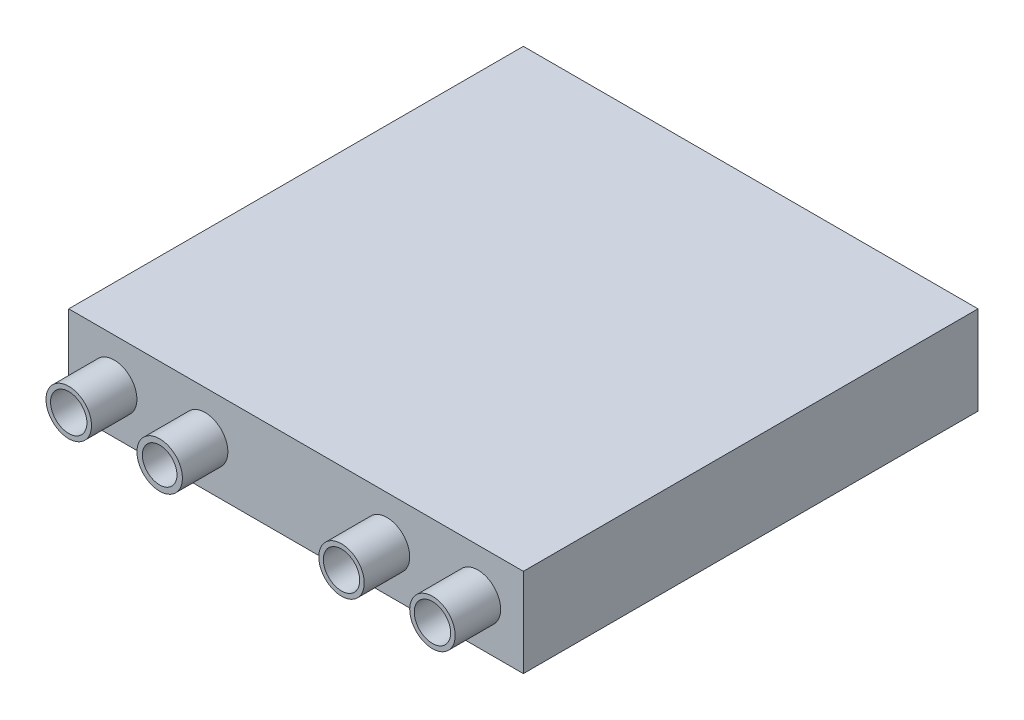
from build123d import *

# Parameters (mm, degrees)
SKETCH1_W           = 1000
SKETCH1_H           = 195
BOSS_EXTRUDE1_DEPTH = 1000
SKETCH2_R           = 50
SKETCH2_R_2         = 40
SKETCH2_R_3         = 38.049771674
BOSS_EXTRUDE2_DEPTH = 100
CUT_EXTRUDE1_START  = -964
SKETCH5_R           = 40
SKETCH5_R_2         = 38.049771674
CUT_EXTRUDE1_DEPTH  = 964


with BuildPart() as part:
    # Sketch1 → Boss-Extrude1 (new body)
    with BuildSketch(Plane.XY):
        with Locations((500, -97.5)):
            Rectangle(SKETCH1_W, SKETCH1_H)
    extrude(amount=BOSS_EXTRUDE1_DEPTH)

    # Sketch2 → Boss-Extrude2 (add)
    # profile 1 of 4: a face of its own
    with BuildSketch(Plane.XY.offset(1000)):
        with Locations((100, -97.5)):
            Circle(SKETCH2_R)
        with Locations((100, -97.5)):
            Circle(SKETCH2_R_2, mode=Mode.SUBTRACT)
    # profile 2 of 4: a face of its own
    with BuildSketch(Plane.XY.offset(1000)):
        with Locations((300, -97.5)):
            Circle(SKETCH2_R)
        with Locations((300, -97.5)):
            Circle(SKETCH2_R_3, mode=Mode.SUBTRACT)
    # profile 3 of 4: a face of its own
    with BuildSketch(Plane.XY.offset(1000)):
        with Locations((700, -97.5)):
            Circle(SKETCH2_R)
        with Locations((700, -97.5)):
            Circle(SKETCH2_R_2, mode=Mode.SUBTRACT)
    # profile 4 of 4: a face of its own
    with BuildSketch(Plane.XY.offset(1000)):
        with Locations((900, -97.5)):
            Circle(SKETCH2_R)
        with Locations((900, -97.5)):
            Circle(SKETCH2_R_2, mode=Mode.SUBTRACT)
    extrude(amount=BOSS_EXTRUDE2_DEPTH)

    # Sketch5 → Cut-Extrude1 (cut)
    with BuildSketch(Plane.XY.offset(1000).offset(CUT_EXTRUDE1_START)):
        with Locations((100, -97.5)):
            Circle(SKETCH5_R)
        with Locations((300, -97.5)):
            Circle(SKETCH5_R_2)
        with Locations((700, -97.5)):
            Circle(SKETCH5_R)
        with Locations((900, -97.5)):
            Circle(SKETCH5_R)
    extrude(amount=CUT_EXTRUDE1_DEPTH, mode=Mode.SUBTRACT)


solid = part.part
